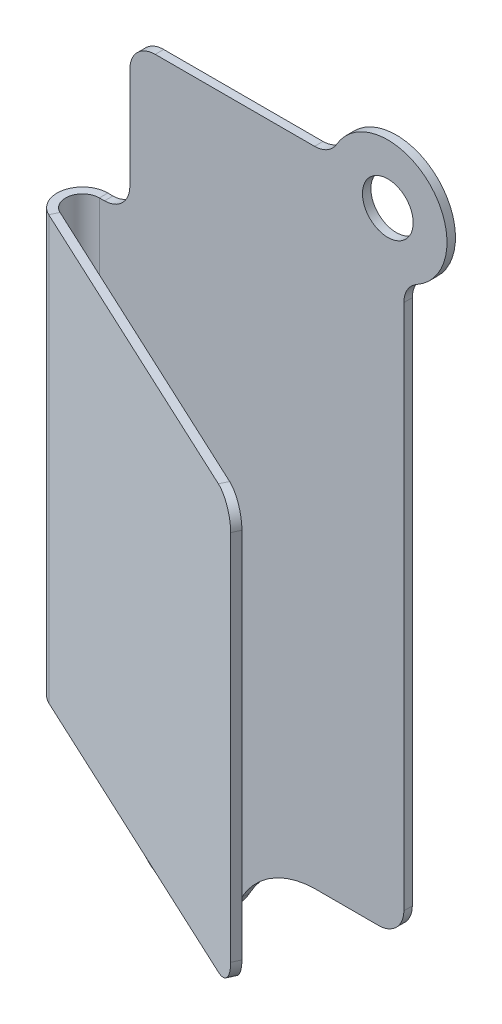
from build123d import *

# Parameters (mm, degrees)
SKETCH1_R           = 3
BOSS_EXTRUDE1_DEPTH = 1
EDGE_FLANGE1_DEPTH  = 50
FILLET1_R           = 3
FILLET2_R           = 10


# Sheet-metal steps are written as plain solids
with BuildPart() as part:
    # Sketch1 → Boss-Extrude1 (new body)
    with BuildSketch(Plane.XY):
        with BuildLine():
            Line((6.708203932, 2), (25.4, 2))
            Line((25.4, 2), (25.4, 69.262789895))
            ThreePointArc((25.4, 69.262789895), (28.486423204, 80.912797943), (16.791796068, 78))
            Line((16.791796068, 78), (-7, 78))
            Line((-7, 78), (-7, 60))
            Line((-7, 60), (-10.6, 60))
            Line((-10.6, 60), (-10.6, 10))
            Line((-10.6, 10), (-7, 10))
            Line((-7, 10), (-7, 0))
            ThreePointArc((-7, 0), (1.010587075, -6.926666858), (6.708203932, 2))
        make_face()
        Circle(SKETCH1_R, mode=Mode.SUBTRACT)
        with Locations((23.5, 76)):
            Circle(SKETCH1_R, mode=Mode.SUBTRACT)
    extrude(amount=BOSS_EXTRUDE1_DEPTH)

    # Edge-Flange1 section (across the edge) → Edge-Flange1 (add)
    with BuildSketch(Plane(origin=(-19.621417007, 60, 1), x_dir=(0.4226182617407006, 0, -0.9063077870366494), z_dir=(0, -1, 0))):
        with BuildLine():
            Line((-1, 9.021417007), (-1, 53.489291496))
            Line((-1, 53.489291496), (0, 53.489291496))
            Line((0, 53.489291496), (0, 9.021417007))
            ThreePointArc((0, 9.021417007), (1.567120772, 7.068824993), (3.812615574, 8.176180484))
            Line((3.812615574, 8.176180484), (4.718923361, 7.753562222))
            ThreePointArc((4.718923361, 7.753562222), (1.350681158, 6.092528986), (-1, 9.021417007))
        make_face()
    extrude(amount=EDGE_FLANGE1_DEPTH)

    # Fillet1
    fillet1_edges = [part.edges().sort_by_distance(p)[0] for p in [
        (-7, 78, 0.5),
        (-7, 60, 0.5),
        (-7, 10, 0.5),
        (25.4, 2, 0.5),
        (25.4, 69.262789895, 0.5),
        (16.791796068, 78, 0.5),
        (28.645035268, 60, 24.058705287),
        (28.645035268, 10, 24.058705287),
    ]]
    fillet(fillet1_edges, radius=FILLET1_R)

    # Fillet2
    fillet2_edges = [part.edges().sort_by_distance(p)[0] for p in [
        (6.708203932, 2, 0.5),
    ]]
    fillet(fillet2_edges, radius=FILLET2_R)


solid = part.part
